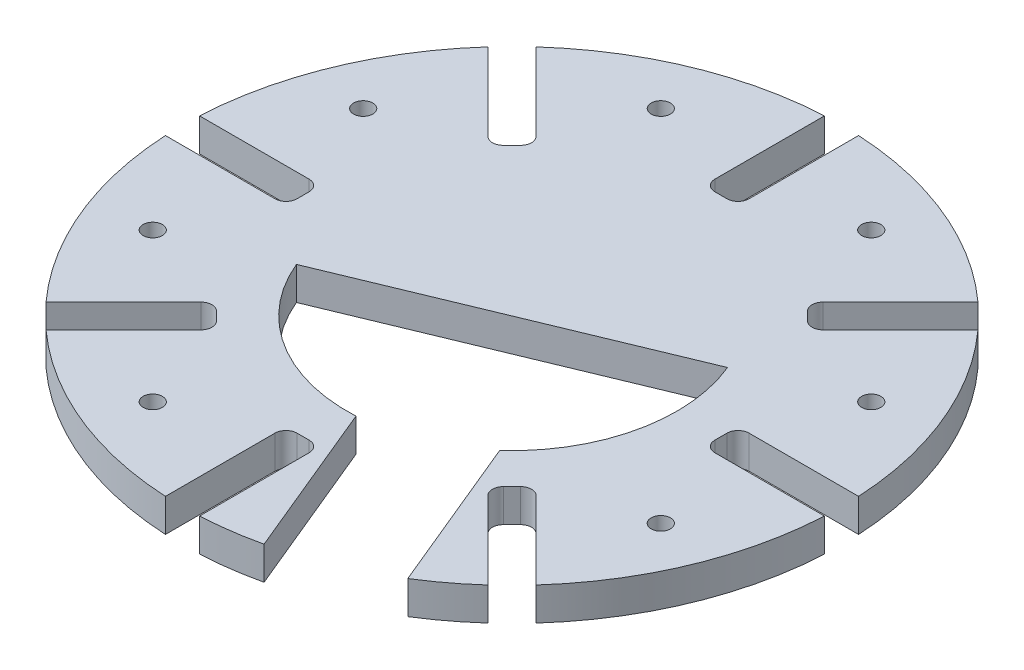
from build123d import *

# Parameters (mm, degrees)
SKETCH_2_R          = 60
EXTRUDE_1_DEPTH     = 6
SKETCH_3_W          = 60
SKETCH_3_H          = 6.2
SKETCH_3_W_2        = 6.2
SKETCH_3_H_2        = 60
CUT_EXTRUDE_1_DEPTH = 6
FILLET_1_R          = 2
CUT_EXTRUDE_2_DEPTH = 10
CUT_EXTRUDE_3_DEPTH = 10
SKETCH_8_R          = 1.75
CUT_EXTRUDE_4_DEPTH = 10


with BuildPart() as part:
    # 草图2 → 凸台-拉伸1 (new body)
    with BuildSketch(Plane(origin=(0, 0, 0), x_dir=(1, 0, 0), z_dir=(0, 1, 0))):
        Circle(SKETCH_2_R)
    extrude(amount=EXTRUDE_1_DEPTH)

    # 草图3 → 切除-拉伸1 (cut)
    with BuildSketch(Plane(origin=(0, 6, 0), x_dir=(1, 0, 0), z_dir=(0, 1, 0))):
        with Locations((68, 0)):
            Rectangle(SKETCH_3_W, SKETCH_3_H)
        Polygon((24.678026663, -29.062088707), (67.104433535, -71.488495578), (71.488495578, -67.104433535), (29.062088707, -24.678026663), align=None)
        with Locations((0, -68)):
            Rectangle(SKETCH_3_W_2, SKETCH_3_H_2)
        Polygon((-29.062088707, -24.678026663), (-71.488495578, -67.104433535), (-67.104433535, -71.488495578), (-24.678026663, -29.062088707), align=None)
        with Locations((-68, 0)):
            Rectangle(SKETCH_3_W, SKETCH_3_H)
        Polygon((-24.678026663, 29.062088707), (-67.104433535, 71.488495578), (-71.488495578, 67.104433535), (-29.062088707, 24.678026663), align=None)
        with Locations((0, 68)):
            Rectangle(SKETCH_3_W_2, SKETCH_3_H_2)
        Polygon((29.062088707, 24.678026663), (71.488495578, 67.104433535), (67.104433535, 71.488495578), (24.678026663, 29.062088707), align=None)
    extrude(amount=-CUT_EXTRUDE_1_DEPTH, mode=Mode.SUBTRACT)

    # 圆角1
    fillet_1_edges = [part.edges().sort_by_distance(p)[0] for p in [
        (38, 3, 3.1),
        (38, 3, -3.1),
        (24.678026663, 3, 29.062088707),
        (29.062088707, 3, 24.678026663),
        (-3.1, 3, 38),
        (3.1, 3, 38),
        (-29.062088707, 3, 24.678026663),
        (-24.678026663, 3, 29.062088707),
        (-38, 3, 3.1),
        (-38, 3, -3.1),
        (-29.062088707, 3, -24.678026663),
        (-24.678026663, 3, -29.062088707),
        (-3.1, 3, -38),
        (3.1, 3, -38),
        (24.678026663, 3, -29.062088707),
        (29.062088707, 3, -24.678026663),
    ]]
    fillet(fillet_1_edges, radius=FILLET_1_R)

    # 草图6 → 切除-拉伸2 (cut)
    with BuildSketch(Plane(origin=(0, 6, 0), x_dir=(1, 0, 0), z_dir=(0, 1, 0))):
        Polygon((-5.411961001, -13.065629649), (13.065629649, -5.411961001), (36.026635591, -60.844732952), (17.54904494, -68.498401599), align=None)
    extrude(amount=-CUT_EXTRUDE_2_DEPTH, mode=Mode.SUBTRACT)

    # 草图7 → 切除-拉伸3 (cut)
    with BuildSketch(Plane(origin=(0, 6, 0), x_dir=(1, 0, 0), z_dir=(0, 1, 0))):
        with BuildLine():
            Line((-27.716385975, -11.480502971), (27.716385975, 11.480502971))
            ThreePointArc((27.716385975, 11.480502971), (11.480502971, -27.716385975), (-27.716385975, -11.480502971))
        make_face()
    extrude(amount=-CUT_EXTRUDE_3_DEPTH, mode=Mode.SUBTRACT)

    # 草图8 → 切除-拉伸4 (cut)
    with BuildSketch(Plane(origin=(0, 6, 0), x_dir=(1, 0, 0), z_dir=(0, 1, 0))):
        with Locations((46.193976626, 19.134171618)):
            Circle(SKETCH_8_R)
        with Locations((46.193976626, -19.134171618)):
            Circle(SKETCH_8_R)
        with Locations((-19.134171618, -46.193976626)):
            Circle(SKETCH_8_R)
        with Locations((-46.193976626, -19.134171618)):
            Circle(SKETCH_8_R)
        with Locations((-46.193976626, 19.134171618)):
            Circle(SKETCH_8_R)
        with Locations((-19.134171618, 46.193976626)):
            Circle(SKETCH_8_R)
        with Locations((19.134171618, 46.193976626)):
            Circle(SKETCH_8_R)
    extrude(amount=-CUT_EXTRUDE_4_DEPTH, mode=Mode.SUBTRACT)


solid = part.part
